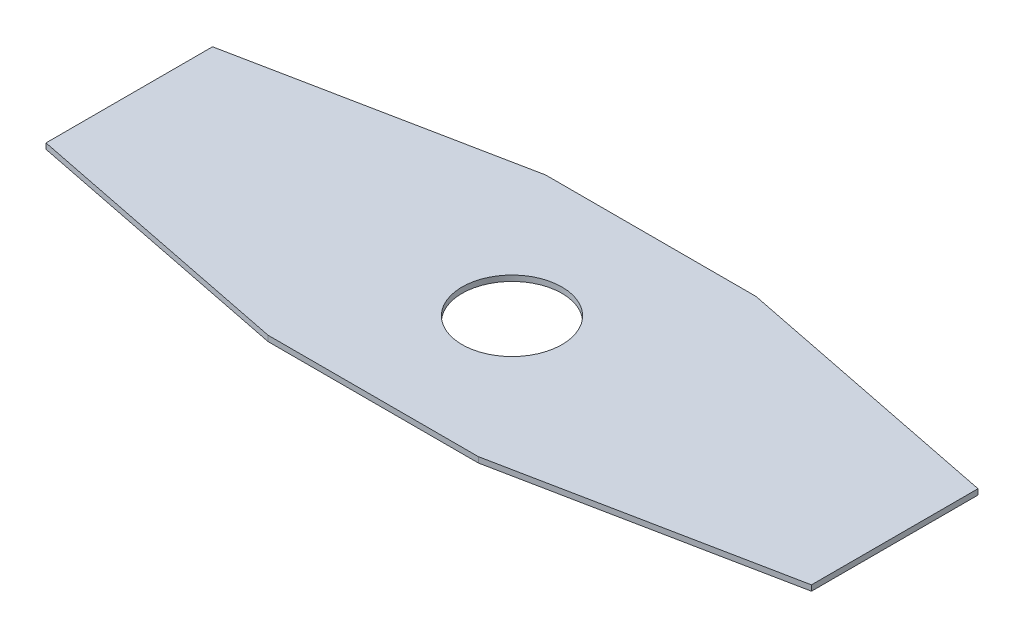
from build123d import *

# Parameters (mm, degrees)
SKETCH1_R           = 9
BOSS_EXTRUDE1_DEPTH = 1


with BuildPart() as part:
    # Sketch1 → Boss-Extrude1 (new body)
    with BuildSketch(Plane(origin=(0, 0, 0), x_dir=(1, 0, 0), z_dir=(0, 1, 0))):
        Polygon((-18.945095217, 25), (18.945095217, 25), (68.945095217, 15), (68.945095217, -15), (18.945095217, -25), (-18.945095217, -25), (-68.945095217, -15), (-68.945095217, 15), align=None)
        with Locations(Location((0, 0, 0), (0, 0, 270))):
            Circle(SKETCH1_R, mode=Mode.SUBTRACT)
    extrude(amount=BOSS_EXTRUDE1_DEPTH)


solid = part.part
